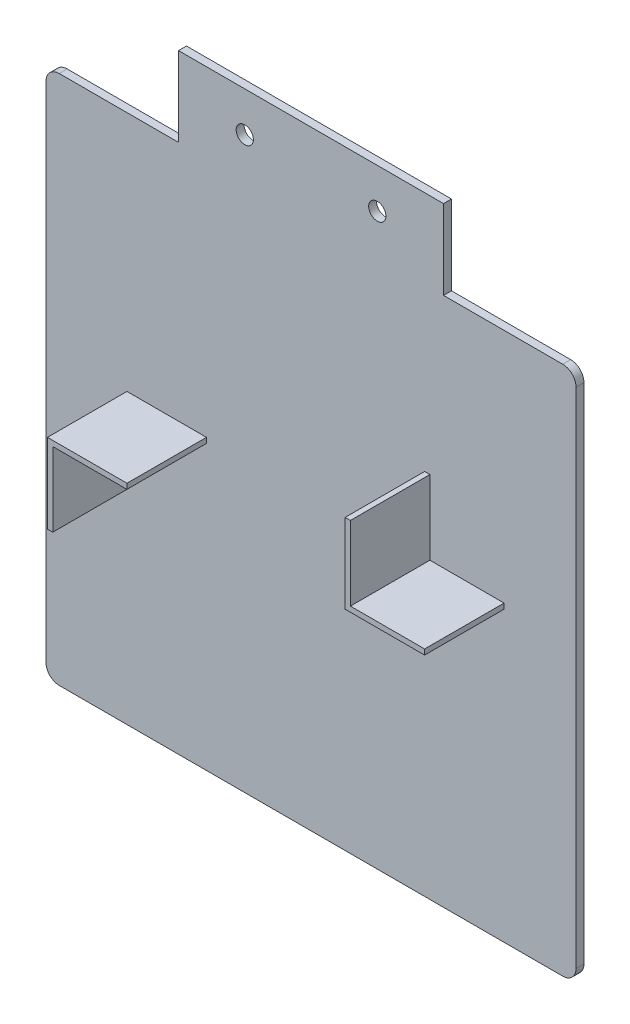
from build123d import *

# Parameters (mm, degrees)
SKETCH1_R           = 3.25
BASE_FLANGE1_DEPTH  = 3
BOSS_EXTRUDE1_DEPTH = 30


# Sheet-metal steps are written as plain solids
with BuildPart() as part:
    # Sketch1 → Base-Flange1 (new body)
    with BuildSketch(Plane.XY):
        with BuildLine():
            Line((-79.914529915, 72.264957265), (-79.914529915, 42.264957265))
            Line((-79.914529915, 42.264957265), (-124.914529915, 42.264957265))
            ThreePointArc((-124.914529915, 42.264957265), (-128.45006382, 40.800491171), (-129.914529915, 37.264957265))
            Line((-129.914529915, 37.264957265), (-129.914529915, -152.735042735))
            ThreePointArc((-129.914529915, -152.735042735), (-128.45006382, -156.270576641), (-124.914529915, -157.735042735))
            Line((-124.914529915, -157.735042735), (65.085470085, -157.735042735))
            ThreePointArc((65.085470085, -157.735042735), (68.621003991, -156.270576641), (70.085470085, -152.735042735))
            Line((70.085470085, -152.735042735), (70.085470085, 37.264957265))
            ThreePointArc((70.085470085, 37.264957265), (68.621003991, 40.800491171), (65.085470085, 42.264957265))
            Line((65.085470085, 42.264957265), (20.085470085, 42.264957265))
            Line((20.085470085, 42.264957265), (20.085470085, 72.264957265))
            Line((20.085470085, 72.264957265), (-79.914529915, 72.264957265))
        make_face()
        with Locations((-4.914529915, 57.264957265)):
            Circle(SKETCH1_R, mode=Mode.SUBTRACT)
        with Locations((-54.914529915, 57.264957265)):
            Circle(SKETCH1_R, mode=Mode.SUBTRACT)
    extrude(amount=-BASE_FLANGE1_DEPTH)

    # Sketch2 → Boss-Extrude1 (add)
    with BuildSketch(Plane.XY):
        Polygon((42.945575149, -48.857914887), (12.945575149, -48.857914887), (12.945575149, -18.857914887), (14.945575149, -18.857914887), (14.945575149, -46.857914887), (42.945575149, -46.857914887), align=None)
        Polygon((-69.377458811, -48.857914887), (-99.377458811, -48.857914887), (-99.377458811, -78.857914887), (-97.377458811, -78.857914887), (-97.377458811, -50.857914887), (-69.377458811, -50.857914887), align=None)
    extrude(amount=BOSS_EXTRUDE1_DEPTH)


solid = part.part
